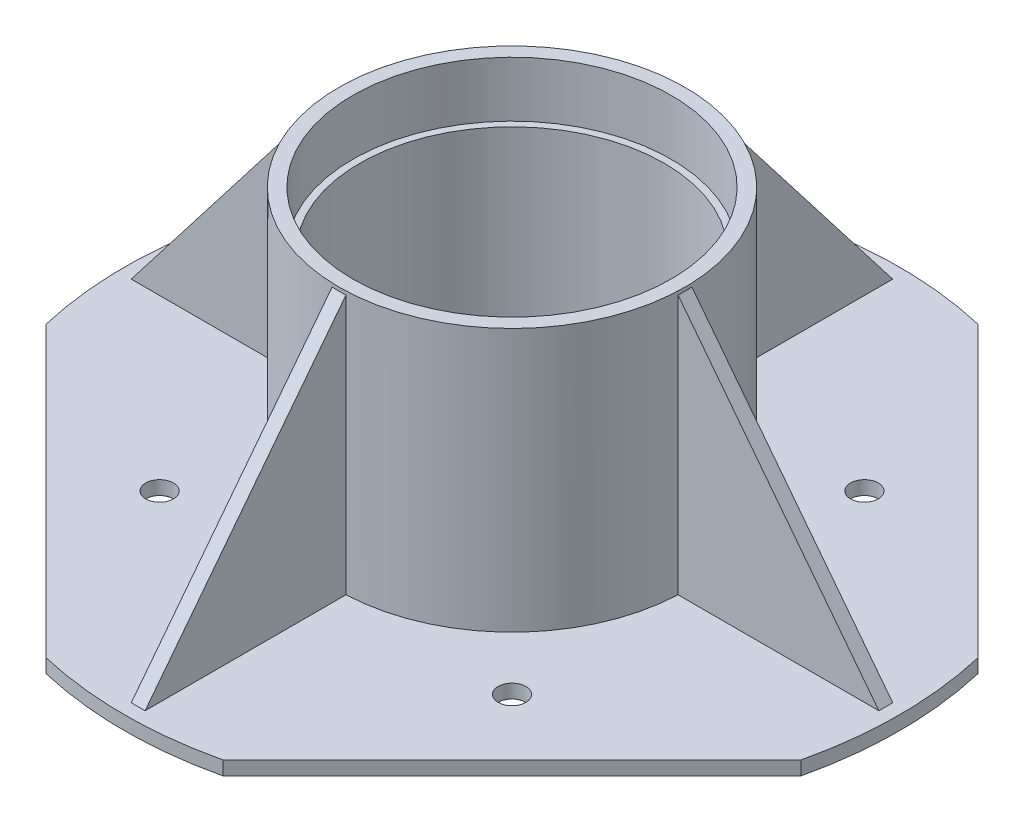
from build123d import *

# Parameters (mm, degrees)
SKETCH1_R                        = 140
SKETCH1_R_2                      = 62.5
BOSS_EXTRUDE1_DEPTH              = 5
SKETCH1_3_R                      = 62.5
SKETCH1_3_R_2                    = 57.5
SKETCH1_3_R_3                    = 55
BOSS_EXTRUDE2_DEPTH              = 100
SKETCH1_4_R                      = 57.5
SKETCH1_4_R_2                    = 55
CUT_EXTRUDE1_DEPTH               = 20
CUT_EXTRUDE2_START               = -20
SKETCH2_R                        = 57.5
CUT_EXTRUDE2_DEPTH               = 20
F_10_0MM_DOWEL_HOLE1_D           = 10
F_10_0MM_DOWEL_HOLE1_CSINK_D     = 10.05
F_10_0MM_DOWEL_HOLE1_CSINK_ANGLE = 90
CUT_EXTRUDE3_DEPTH               = 5
RIB4_START                       = -2.5
RIB4_DEPTH                       = 5
RIB5_REACH                       = 223.811
SKETCH9_WALL_W                   = 565.734948258
SKETCH9_WALL_H                   = 5
RIB6_REACH                       = 223.811
SKETCH10_WALL_W                  = 565.734948258
SKETCH10_WALL_H                  = 5
RIB7_REACH                       = 223.811
SKETCH11_WALL_W                  = 565.734948258
SKETCH11_WALL_H                  = 5


# Read off the part's stored shape, not the designer's step: Rib4
with BuildPart() as part:
    # Sketch1 → Boss-Extrude1 (new body)
    with BuildSketch(Plane(origin=(0, 0, 0), x_dir=(1, 0, 0), z_dir=(0, 1, 0))):
        with Locations(Location((0, 0, 0), (0, 0, 270))):
            Circle(SKETCH1_R)
        with Locations(Location((0, 0, 0), (0, 0, 270))):
            Circle(SKETCH1_R_2, mode=Mode.SUBTRACT)
    extrude(amount=BOSS_EXTRUDE1_DEPTH)

    # Sketch1<3> → Boss-Extrude2 (add)
    # profile 1 of 2: a face of its own
    with BuildSketch(Plane(origin=(0, 0, 0), x_dir=(1, 0, 0), z_dir=(0, 1, 0))):
        with Locations(Location((0, 0, 0), (0, 0, 270))):
            Circle(SKETCH1_3_R)
        Circle(SKETCH1_3_R_2, mode=Mode.SUBTRACT)
    # profile 2 of 2: a face of its own
    with BuildSketch(Plane(origin=(0, 0, 0), x_dir=(1, 0, 0), z_dir=(0, 1, 0))):
        Circle(SKETCH1_3_R_2)
        with Locations(Location((0, 0, 0), (0, 0, 270))):
            Circle(SKETCH1_3_R_3, mode=Mode.SUBTRACT)
    extrude(amount=BOSS_EXTRUDE2_DEPTH)

    # Sketch1<4> → Cut-Extrude1 (cut)
    with BuildSketch(Plane(origin=(0, 0, 0), x_dir=(1, 0, 0), z_dir=(0, 1, 0))):
        with Locations(Location((0, 0, 0), (0, 0, 270))):
            Circle(SKETCH1_4_R)
        with Locations(Location((0, 0, 0), (0, 0, 270))):
            Circle(SKETCH1_4_R_2, mode=Mode.SUBTRACT)
    extrude(amount=CUT_EXTRUDE1_DEPTH, mode=Mode.SUBTRACT)

    # Sketch2 → Cut-Extrude2 (cut)
    with BuildSketch(Plane(origin=(0, 100, 0), x_dir=(1, 0, 0), z_dir=(0, 1, 0)).offset(CUT_EXTRUDE2_START)):
        with Locations(Location((0, 0, 0), (0, 0, 270))):
            Circle(SKETCH2_R)
    extrude(amount=CUT_EXTRUDE2_DEPTH, mode=Mode.SUBTRACT)

    # Ø10.0mm Dowel Hole1 (through all)
    with Locations(Plane.XZ):
        with Locations((-63.639461911, -63.639758703), (63.639461911, -63.639758703), (63.639461911, 63.639758703), (-63.639461911, 63.639758703), (-63.582280459, -63.582280459)):
            CounterSinkHole(F_10_0MM_DOWEL_HOLE1_D / 2, F_10_0MM_DOWEL_HOLE1_CSINK_D / 2, counter_sink_angle=F_10_0MM_DOWEL_HOLE1_CSINK_ANGLE)

    # Sketch8 → Cut-Extrude3 (cut)
    with BuildSketch(Plane(origin=(0, 0, 0), x_dir=(1, 0, 0), z_dir=(0, 1, 0))):
        with BuildLine():
            ThreePointArc((31.996881471, 136.294532451), (136.294532451, 136.294532451), (136.294532451, 31.996881471))
            Line((136.294532451, 31.996881471), (31.996881471, 136.294532451))
        make_face()
        with BuildLine():
            Line((31.996881471, -136.294532451), (136.294532451, -31.996881471))
            ThreePointArc((136.294532451, -31.996881471), (136.294532451, -136.294532451), (31.996881471, -136.294532451))
        make_face()
        with BuildLine():
            Line((-31.996881471, -136.294532451), (-84.145706961, -84.145706961))
            Line((-84.145706961, -84.145706961), (-136.294532451, -31.996881471))
            ThreePointArc((-136.294532451, -31.996881471), (-136.294532451, -136.294532451), (-31.996881471, -136.294532451))
        make_face()
        with BuildLine():
            Line((-136.294532451, 31.996881471), (-31.996881471, 136.294532451))
            ThreePointArc((-31.996881471, 136.294532451), (-136.294532451, 136.294532451), (-136.294532451, 31.996881471))
        make_face()
    extrude(amount=CUT_EXTRUDE3_DEPTH, mode=Mode.SUBTRACT)

    # Rib4 outline → Rib4 (add)
    with BuildSketch(Plane.XY.offset(RIB4_START)):
        Polygon((-61.5, 100), (-62.449979984, 98.772134715), (-135, 5), (-61, 5), (-61, 100), align=None)
    extrude(amount=RIB4_DEPTH)

    # Sketch9 wall → Rib5 (add, up to next)
    with BuildSketch(Plane(origin=(98.25, 52.5, 0), x_dir=(0.611921285633, -0.790918668505, 0), z_dir=(0.790918668505, 0.611921285633, 0)), mode=Mode.PRIVATE) as rib5_sk1:
        Rectangle(SKETCH9_WALL_W, SKETCH9_WALL_H)
    rib5_tool1 = extrude(rib5_sk1.sketch, amount=-RIB5_REACH, mode=Mode.PRIVATE) - part.part
    add(rib5_tool1.solids().sort_by_distance((98.25, 52.5, 0))[0])

    # Sketch10 wall → Rib6 (add, up to next)
    with BuildSketch(Plane(origin=(0, 52.5, 98.25), x_dir=(0, -0.790918668505, 0.611921285633), z_dir=(0, -0.611921285633, -0.790918668505)), mode=Mode.PRIVATE) as rib6_sk1:
        Rectangle(SKETCH10_WALL_W, SKETCH10_WALL_H)
    rib6_tool1 = extrude(rib6_sk1.sketch, amount=RIB6_REACH, mode=Mode.PRIVATE) - part.part
    add(rib6_tool1.solids().sort_by_distance((0, 52.5, 98.25))[0])

    # Sketch11 wall → Rib7 (add, up to next)
    with BuildSketch(Plane(origin=(0, 52.5, -98.25), x_dir=(0, -0.790918668505, -0.611921285633), z_dir=(0, 0.611921285633, -0.790918668505)), mode=Mode.PRIVATE) as rib7_sk1:
        Rectangle(SKETCH11_WALL_W, SKETCH11_WALL_H)
    rib7_tool1 = extrude(rib7_sk1.sketch, amount=-RIB7_REACH, mode=Mode.PRIVATE) - part.part
    add(rib7_tool1.solids().sort_by_distance((0, 52.5, -98.25))[0])


solid = part.part
